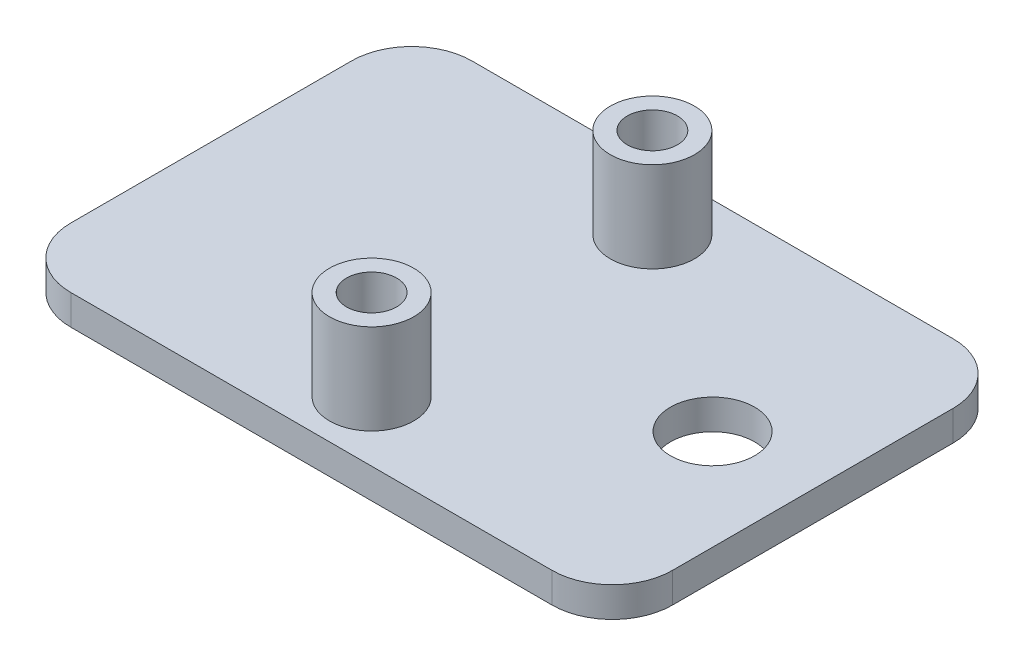
from build123d import *

# Parameters (mm, degrees)
SKETCH_1_R             = 2.1
SM_BASE_FLANGE_1_DEPTH = 1.5
SKETCH_2_R             = 2.1
EXTRUDE_1_DEPTH        = 4.5
HOLE_WIZARD_M3_1_D     = 2.5
HOLE_WIZARD_M3_1_DEPTH = 4


# Sheet-metal steps are written as plain solids
with BuildPart() as part:
    # Sketch 1 → 基体-法兰1 (new body)
    with BuildSketch(Plane(origin=(0, 0, 0), x_dir=(1, 0, 0), z_dir=(0, 1, 0))):
        with BuildLine():
            Line((-7.384325118, 10), (16.615674882, 10))
            ThreePointArc((16.615674882, 10), (18.736995226, 9.121320344), (19.615674882, 7))
            Line((19.615674882, 7), (19.615674882, -7))
            ThreePointArc((19.615674882, -7), (18.736995226, -9.121320344), (16.615674882, -10))
            Line((16.615674882, -10), (-7.384325118, -10))
            ThreePointArc((-7.384325118, -10), (-9.505645461, -9.121320344), (-10.384325118, -7))
            Line((-10.384325118, -7), (-10.384325118, 7))
            ThreePointArc((-10.384325118, 7), (-9.505645461, 9.121320344), (-7.384325118, 10))
        make_face()
        with Locations(Location((14.615674882, 0, 0), (0, 0, 270))):
            Circle(SKETCH_1_R, mode=Mode.SUBTRACT)
    extrude(amount=-SM_BASE_FLANGE_1_DEPTH)

    # Sketch 2 → 凸台-拉伸1 (add)
    with BuildSketch(Plane(origin=(0, 0, 0), x_dir=(1, 0, 0), z_dir=(0, 1, 0))):
        with Locations(Location((4.615674882, 7, 0), (0, 0, 270))):
            Circle(SKETCH_2_R)
        with Locations(Location((4.615674882, -7, 0), (0, 0, 270))):
            Circle(SKETCH_2_R)
    extrude(amount=EXTRUDE_1_DEPTH)

    # M3 螺纹孔1
    with Locations(Plane(origin=(0, 4.5, 0), x_dir=(1, 0, 0), z_dir=(0, 1, 0))):
        with Locations((4.615674882, 7), (4.615674882, -7)):
            Hole(HOLE_WIZARD_M3_1_D / 2, depth=HOLE_WIZARD_M3_1_DEPTH)


solid = part.part
